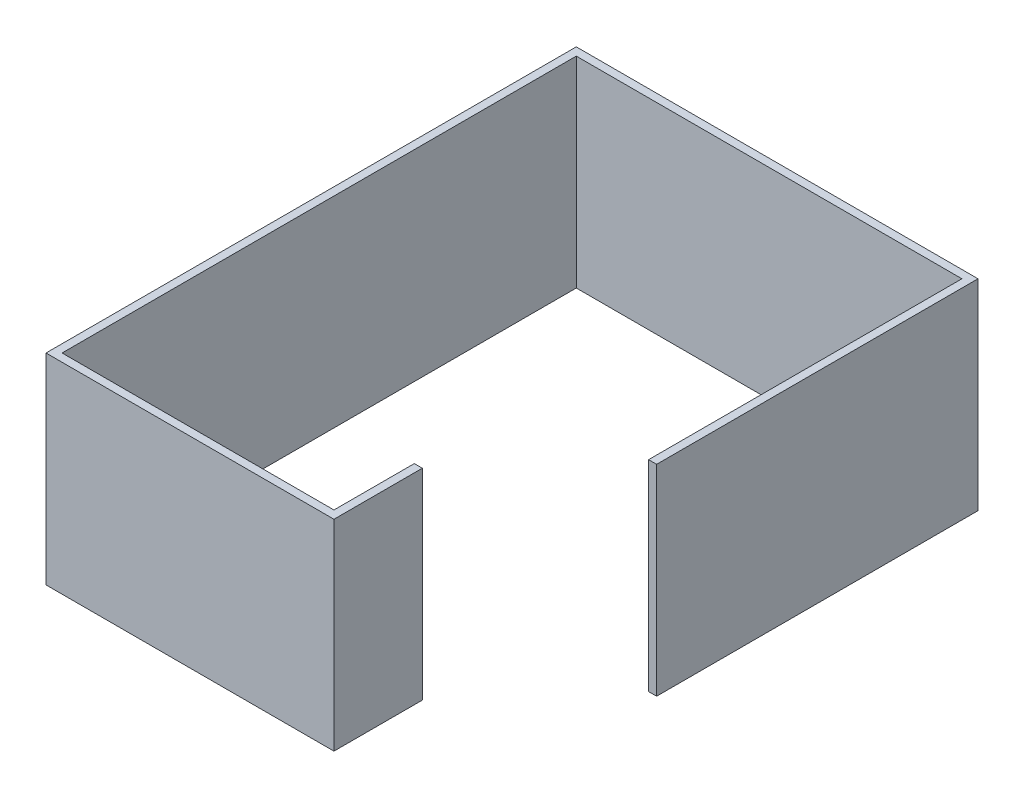
from build123d import *

# Parameters (mm, degrees)
BOSS_EXTRUDE1_DEPTH = 250
SKETCH3_W           = 10
SKETCH3_H           = 100
CUT_EXTRUDE1_DEPTH  = 250
SKETCH4_W           = 10
SKETCH4_H           = 250
BOSS_EXTRUDE2_DEPTH = 160
SKETCH5_W           = 10
SKETCH5_H           = 250
BOSS_EXTRUDE3_DEPTH = 348.4
SKETCH6_W           = 10
SKETCH6_H           = 250
BOSS_EXTRUDE4_DEPTH = 100


with BuildPart() as part:
    # Sketch1 → Boss-Extrude1 (new body)
    with BuildSketch(Plane(origin=(0, 0, 0), x_dir=(1, 0, 0), z_dir=(0, 1, 0))):
        Polygon((-250, 0), (-250, 500), (250, 500), (250, 0), (240, 0), (240, 490), (-240, 490), (-240, 0), align=None)
    extrude(amount=BOSS_EXTRUDE1_DEPTH)

    # Sketch3 → Cut-Extrude1 (cut)
    with BuildSketch(Plane(origin=(0, 250, 0), x_dir=(1, 0, 0), z_dir=(0, 1, 0))):
        with Locations((245, 50)):
            Rectangle(SKETCH3_W, SKETCH3_H)
    extrude(amount=-CUT_EXTRUDE1_DEPTH, mode=Mode.SUBTRACT)

    # Sketch4 → Boss-Extrude2 (add)
    with BuildSketch(Plane.XY):
        with Locations((-245, 125)):
            Rectangle(SKETCH4_W, SKETCH4_H)
    extrude(amount=BOSS_EXTRUDE2_DEPTH)

    # Sketch5 → Boss-Extrude3 (add)
    with BuildSketch(Plane(origin=(-240, 0, 0), x_dir=(0, 0, -1), z_dir=(1, 0, 0))):
        with Locations((-155, 125)):
            Rectangle(SKETCH5_W, SKETCH5_H)
    extrude(amount=BOSS_EXTRUDE3_DEPTH)

    # Sketch6 → Boss-Extrude4 (add)
    with BuildSketch(Plane(origin=(0, 0, 150), x_dir=(-1, 0, 0), z_dir=(0, 0, -1))):
        with Locations((-103.4, 125)):
            Rectangle(SKETCH6_W, SKETCH6_H)
    extrude(amount=BOSS_EXTRUDE4_DEPTH)


solid = part.part
